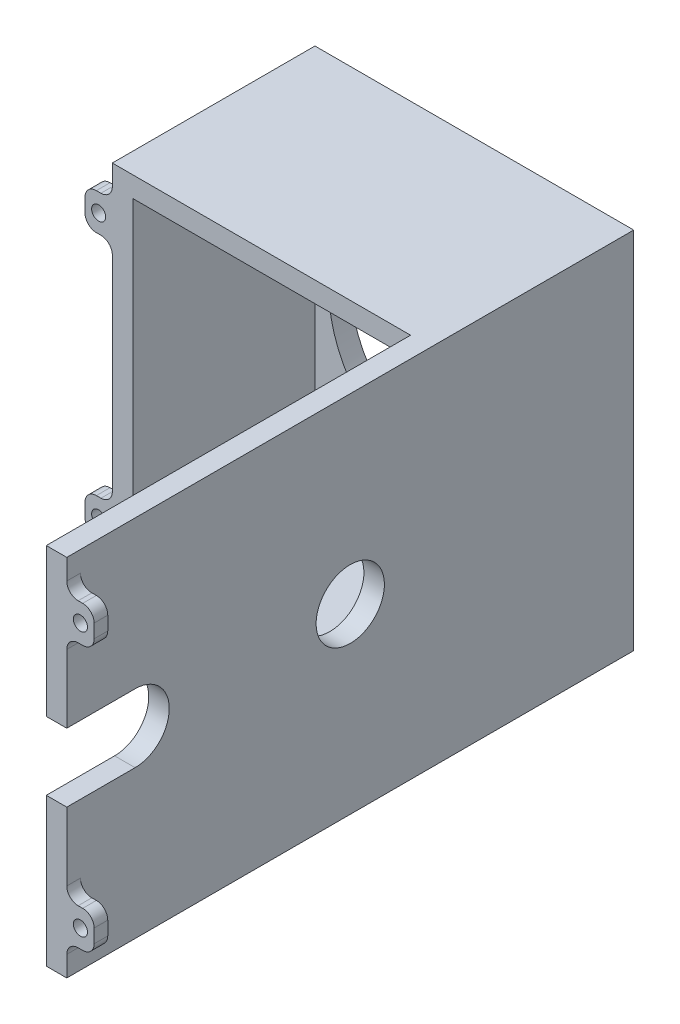
from build123d import *

# Parameters (mm, degrees)
SKETCH1_W               = 80
SKETCH1_H               = 70
BOSS_EXTRUDE1_DEPTH     = 4.5
SKETCH2_W               = 4.5
SKETCH2_H               = 80
BOSS_EXTRUDE2_DEPTH     = 120
BOSS_EXTRUDE3_DEPTH     = 40
CUT_EXTRUDE1_REACH      = 137.371
SKETCH4_R               = 27.5
CUT_EXTRUDE2_REACH      = 148.255
SKETCH5_R               = 7.5
SKETCH6_W               = 6
SKETCH6_H               = 8
BOSS_EXTRUDE4_DEPTH     = 3
SKETCH7_W               = 6
SKETCH7_H               = 8
BOSS_EXTRUDE5_DEPTH     = 3
CUT_EXTRUDE4_DEPTH      = 99.392072851
CUT_EXTRUDE4_DEPTH_BACK = 99.392072851
SKETCH8_R               = 1.55
FILLET1_R               = 2.5


with BuildPart() as part:
    # Sketch1 → Boss-Extrude1 (new body)
    with BuildSketch(Plane(origin=(0, 0, 0), x_dir=(0, 1, 0), z_dir=(0, 0, 1))):
        Rectangle(SKETCH1_W, SKETCH1_H)
    extrude(amount=BOSS_EXTRUDE1_DEPTH)

    # Sketch2 → Boss-Extrude2 (add)
    with BuildSketch(Plane.XY.offset(4.5)):
        with Locations((32.75, 0)):
            Rectangle(SKETCH2_W, SKETCH2_H)
    extrude(amount=BOSS_EXTRUDE2_DEPTH)

    # Sketch3 → Boss-Extrude3 (add)
    with BuildSketch(Plane.XY.offset(4.5)):
        Polygon((30.5, 40), (-35, 40), (-35, -40), (30.5, -40), (30.5, -35.5), (-30.5, -35.5), (-30.5, 35.5), (30.5, 35.5), align=None)
    extrude(amount=BOSS_EXTRUDE3_DEPTH)

    # Sketch4 → Cut-Extrude1 (cut, up to next)
    with BuildSketch(Plane(origin=(0, 0, 0), x_dir=(1, 0, 0), z_dir=(0, 0, -1)), mode=Mode.PRIVATE) as cut_extrude1_sk1:
        Circle(SKETCH4_R)
    cut_extrude1_tool1 = extrude(cut_extrude1_sk1.sketch, amount=-CUT_EXTRUDE1_REACH, mode=Mode.PRIVATE) & part.part
    add(cut_extrude1_tool1.solids().sort_by_distance((0, 0, 0))[0], mode=Mode.SUBTRACT)

    # Sketch5 → Cut-Extrude2 (cut, up to next)
    with BuildSketch(Plane(origin=(30.5, 0, 0), x_dir=(0, -1, 0), z_dir=(-1, 0, 0)), mode=Mode.PRIVATE) as cut_extrude2_sk1:
        with Locations((0, 62.25)):
            Circle(SKETCH5_R)
    cut_extrude2_tool1 = extrude(cut_extrude2_sk1.sketch, amount=-CUT_EXTRUDE2_REACH, mode=Mode.PRIVATE) & part.part
    # Sketch5 → Cut-Extrude2 (cut, up to next)
    with BuildSketch(Plane(origin=(30.5, 0, 0), x_dir=(0, -1, 0), z_dir=(-1, 0, 0)), mode=Mode.PRIVATE) as cut_extrude2_sk2:
        with BuildLine():
            Line((-7.5, 124.5), (7.5, 124.5))
            Line((7.5, 124.5), (7.5, 109.5))
            ThreePointArc((7.5, 109.5), (0, 102), (-7.5, 109.5))
            Line((-7.5, 109.5), (-7.5, 124.5))
        make_face()
    cut_extrude2_tool2 = extrude(cut_extrude2_sk2.sketch, amount=-CUT_EXTRUDE2_REACH, mode=Mode.PRIVATE) & part.part
    add(cut_extrude2_tool1.solids().sort_by_distance((30.5, 0, 62.25))[0], mode=Mode.SUBTRACT)
    add(cut_extrude2_tool2.solids().sort_by_distance((30.5, 0, 113.987689))[0], mode=Mode.SUBTRACT)

    # Sketch6 → Boss-Extrude4 (add)
    with BuildSketch(Plane.XY.offset(124.5)):
        with Locations((38, 29)):
            Rectangle(SKETCH6_W, SKETCH6_H)
        with Locations((38, -29)):
            Rectangle(SKETCH6_W, SKETCH6_H)
    extrude(amount=-BOSS_EXTRUDE4_DEPTH)

    # Sketch7 → Boss-Extrude5 (add)
    with BuildSketch(Plane.XY.offset(44.5)):
        with Locations((-38, -29)):
            Rectangle(SKETCH7_W, SKETCH7_H)
        with Locations((-38, 29)):
            Rectangle(SKETCH7_W, SKETCH7_H)
    extrude(amount=-BOSS_EXTRUDE5_DEPTH)

    # Sketch8 → Cut-Extrude4 (cut, two sides: drawn at the far end of the back side and taken through both)
    with BuildSketch(Plane.XY.offset(44.5).offset(-CUT_EXTRUDE4_DEPTH_BACK)):
        with Locations((-38, 29)):
            Circle(SKETCH8_R)
        with Locations((38, 29)):
            Circle(SKETCH8_R)
        with Locations((38, -29)):
            Circle(SKETCH8_R)
        with Locations((-38, -29)):
            Circle(SKETCH8_R)
    extrude(amount=CUT_EXTRUDE4_DEPTH + CUT_EXTRUDE4_DEPTH_BACK, mode=Mode.SUBTRACT)

    # Fillet1
    fillet1_edges = [part.edges().sort_by_distance(p)[0] for p in [
        (35, 33, 123),
        (41, 33, 123),
        (41, 25, 123),
        (35, 25, 123),
        (35, -33, 123),
        (35, -25, 123),
        (41, -25, 123),
        (41, -33, 123),
        (-35, -33, 43),
        (-41, -33, 43),
        (-41, -25, 43),
        (-35, -25, 43),
        (-35, 33, 43),
        (-41, 25, 43),
        (-35, 25, 43),
        (-41, 33, 43),
    ]]
    fillet(fillet1_edges, radius=FILLET1_R)


solid = part.part
